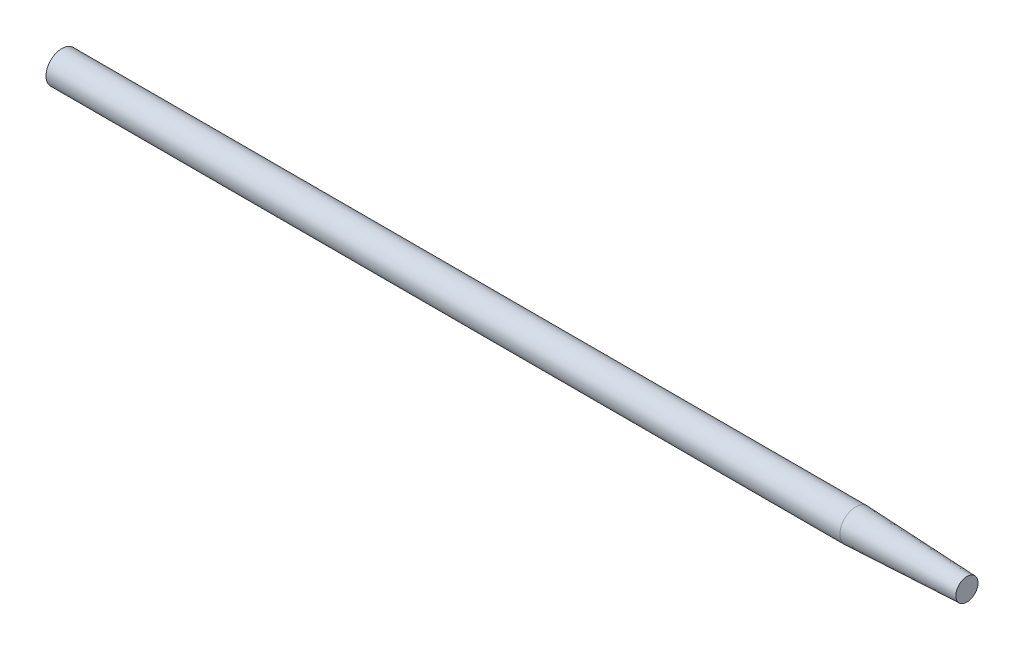
from build123d import *

# Parameters (mm, degrees)
IZIM1_W    = 570
IZIM1_H    = 10
PAH1_SIZE  = 3
PAH1_SIZE2 = 70


with BuildPart() as part:
    # Çizim1 → Döndür1 (revolve)
    with BuildSketch(Plane.XY):
        with Locations((285, 5)):
            Rectangle(IZIM1_W, IZIM1_H)
    revolve(axis=Axis((0, 0, 0), (1, 0, 0)))

    # Pah1
    pah1_edges = [part.edges().sort_by_distance(p)[0] for p in [
        (570, -10, 0),
    ]]
    pah1_side = [part.faces().sort_by_distance(p)[0] for p in [
        (570, 0, 0),
    ]]
    chamfer(pah1_edges, length=PAH1_SIZE, length2=PAH1_SIZE2, reference=pah1_side[0])


solid = part.part
